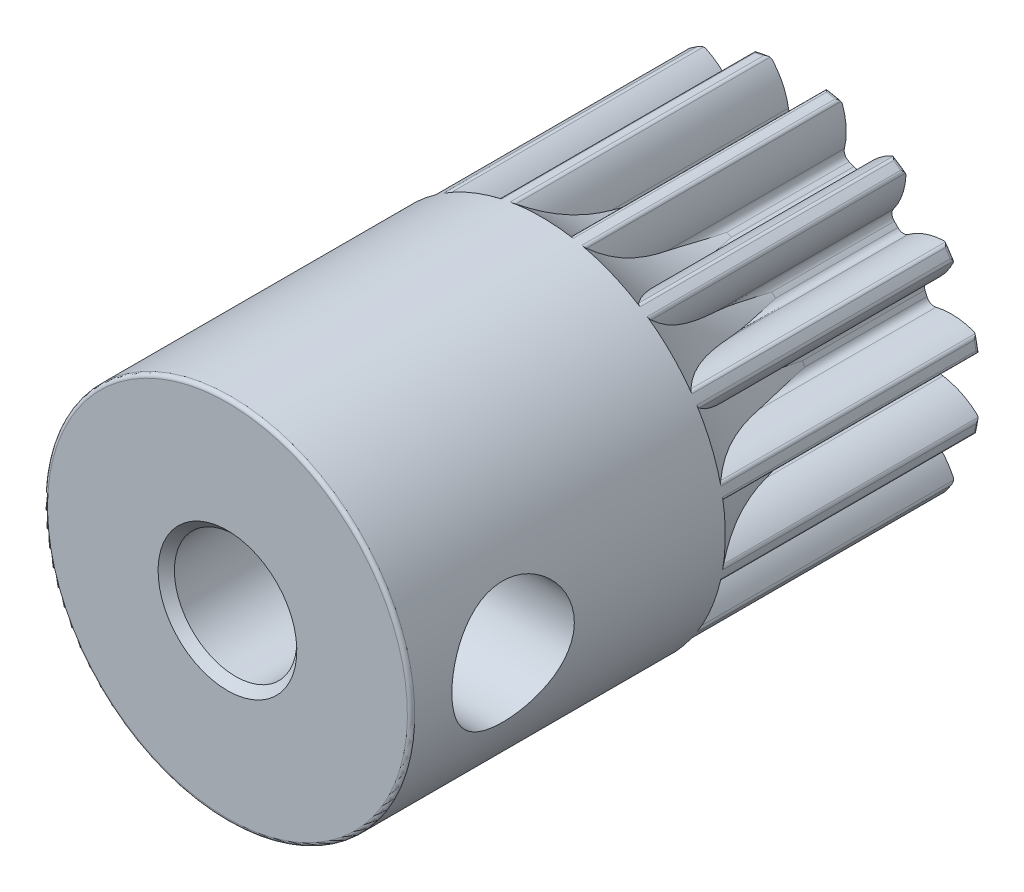
from build123d import *

# Parameters (mm, degrees)
FILLET2_R               = 0.09
CUT_EXTRUDE2_DEPTH      = 6.3
FILLET3_R               = 0.190000001
FILLET4_R               = 0.095000001
CIRPATTERN1_DEPTH       = 6.3
CHAMFER1_SIZE           = 0.2
CUT_EXTRUDE3_REACH      = 19.241
CUT_EXTRUDE3_END_RADIUS = 1.5
SKETCH8_R               = 1.5


# Read off the part's stored shape, not the designer's step: CirPattern1
with BuildPart() as part:
    # Sketch4 → Revolve1 (revolve)
    with BuildSketch(Plane(origin=(0, 0, 0), x_dir=(0, 0, -1), z_dir=(1, 0, 0))):
        Polygon((-14, 1.5), (-14, 4.5), (-3, 4.5), (0, 4.5), (0, 1.5), align=None)
    revolve(axis=Axis((0, 0, 3), (0, 0, 1)))

    # Fillet2
    fillet2_edges = [part.edges().sort_by_distance(p)[0] for p in [
        (0, -4.5, 0),
        (0, -4.5, 14),
    ]]
    fillet(fillet2_edges, radius=FILLET2_R)

    # Sketch7 → Cut-Extrude2 (cut)
    with BuildSketch(Plane.XY):
        with BuildLine():
            ThreePointArc((-0.724826987, 4.441241475), (0, 4.5), (0.724826987, 4.441241475))
            ThreePointArc((0.724826987, 4.441241475), (0.378010211, 3.95063267), (0.236597231, 3.366696676))
            ThreePointArc((0.236597231, 3.366696676), (0, 3.374999964), (-0.236597231, 3.366696676))
            ThreePointArc((-0.236597231, 3.366696676), (-0.378010211, 3.95063267), (-0.724826987, 4.441241475))
        make_face()
    extrude(amount=CUT_EXTRUDE2_DEPTH, mode=Mode.SUBTRACT)

    # Fillet3
    fillet3_edges = [part.edges().sort_by_distance(p)[0] for p in [
        (0.236597231, 3.366696676, 3.15),
        (-0.236597231, 3.366696676, 3.15),
    ]]
    fillet(fillet3_edges, radius=FILLET3_R)

    # Fillet4
    # the kernel refuses this fillet: 0.095000001 mm, written as the material it takes off along each edge
    with BuildSketch(Plane(origin=(0.724826987, 4.441241475, -0.035825584), x_dir=(-0.7092939445034812, -0.7049128316967229, 0), z_dir=(0, 0, 1))) as fillet4_piece_1:
        with BuildLine():
            CenterArc((0.048836055, 0.094988249), FILLET4_R * 0.999999994737, 215.280156673, 55.621039851)
            ThreePointArc((-0.028716024, 0.04011863), (-0.014412994, 0.020019961), (0, 0))
            ThreePointArc((0, 0), (0.025165117, -0.000197913), (0.050330234, 0))
        make_face()
    extrude(amount=6.335825584, mode=Mode.SUBTRACT)
    with BuildSketch(Plane(origin=(-0.724826987, 4.441241475, -0.035825584), x_dir=(0.709293944503482, -0.7049128316967221, 0), z_dir=(0, 0, 1))) as fillet4_piece_2:
        with BuildLine():
            CenterArc((0.048836055, -0.094988249), FILLET4_R * 0.999999994737, 89.098803476, 55.621039851)
            ThreePointArc((-0.028716024, -0.04011863), (-0.014412994, -0.020019961), (0, 0))
            ThreePointArc((0, 0), (0.025165117, 0.000197913), (0.050330234, 0))
        make_face()
    extrude(amount=6.335825584, mode=Mode.SUBTRACT)

    # CirPattern1 outline → CirPattern1 (cut)
    with BuildSketch(Plane.XY):
        with BuildLine():
            ThreePointArc((1.118375515, 3.363153899), (1.1344207, 3.230726591), (1.233569425, 3.141485513))
            ThreePointArc((1.233569425, 3.141485513), (1.29155657, 3.118093389), (1.349100404, 3.093631015))
            ThreePointArc((1.349100404, 3.093631015), (1.482312111, 3.086625251), (1.587298017, 3.168919839))
            ThreePointArc((1.587298017, 3.168919839), (1.905314001, 3.545079708), (2.322683832, 3.806676415))
            ThreePointArc((2.322683832, 3.806676415), (2.367741543, 3.814069788), (2.41104425, 3.79958756))
            ThreePointArc((2.41104425, 3.79958756), (1.722075445, 4.157457896), (0.98184839, 4.391579868))
            ThreePointArc((0.98184839, 4.391579868), (1.022708509, 4.371200713), (1.049341218, 4.334112195))
            ThreePointArc((1.049341218, 4.334112195), (1.159489451, 3.854010352), (1.118375515, 3.363153899))
        make_face()
        with BuildLine():
            ThreePointArc((-1.049341218, 4.334112195), (-1.022708509, 4.371200713), (-0.98184839, 4.391579868))
            ThreePointArc((-0.98184839, 4.391579868), (-1.722075445, 4.157457896), (-2.41104425, 3.79958756))
            ThreePointArc((-2.41104425, 3.79958756), (-2.367741543, 3.814069788), (-2.322683832, 3.806676415))
            ThreePointArc((-2.322683832, 3.806676415), (-1.905314001, 3.545079708), (-1.587298017, 3.168919839))
            ThreePointArc((-1.587298017, 3.168919839), (-1.482312111, 3.086625251), (-1.349100404, 3.093631015))
            ThreePointArc((-1.349100404, 3.093631015), (-1.29155657, 3.118093389), (-1.233569425, 3.141485513))
            ThreePointArc((-1.233569425, 3.141485513), (-1.1344207, 3.230726591), (-1.118375515, 3.363153899))
            ThreePointArc((-1.118375515, 3.363153899), (-1.159489451, 3.854010352), (-1.049341218, 4.334112195))
        make_face()
        with BuildLine():
            ThreePointArc((3.681553644, 2.587694489), (3.181980515, 3.181980515), (2.587694489, 3.681553644))
            ThreePointArc((2.587694489, 3.681553644), (2.617645552, 3.647089268), (2.628057805, 3.602632049))
            ThreePointArc((2.628057805, 3.602632049), (2.546094482, 3.116923879), (2.320267526, 2.679165271))
            ThreePointArc((2.320267526, 2.679165271), (2.284413607, 2.550678166), (2.341864003, 2.430287586))
            ThreePointArc((2.341864003, 2.430287586), (2.386485361, 2.386485361), (2.430287586, 2.341864003))
            ThreePointArc((2.430287586, 2.341864003), (2.550678166, 2.284413607), (2.679165271, 2.320267526))
            ThreePointArc((2.679165271, 2.320267526), (3.116923879, 2.546094482), (3.602632049, 2.628057805))
            ThreePointArc((3.602632049, 2.628057805), (3.647089268, 2.617645552), (3.681553644, 2.587694489))
        make_face()
        with BuildLine():
            ThreePointArc((-2.628057805, 3.602632049), (-2.617645552, 3.647089268), (-2.587694489, 3.681553644))
            ThreePointArc((-2.587694489, 3.681553644), (-3.181980515, 3.181980515), (-3.681553644, 2.587694489))
            ThreePointArc((-3.681553644, 2.587694489), (-3.647089268, 2.617645552), (-3.602632049, 2.628057805))
            ThreePointArc((-3.602632049, 2.628057805), (-3.116923879, 2.546094482), (-2.679165271, 2.320267526))
            ThreePointArc((-2.679165271, 2.320267526), (-2.550678166, 2.284413607), (-2.430287586, 2.341864003))
            ThreePointArc((-2.430287586, 2.341864003), (-2.386485361, 2.386485361), (-2.341864003, 2.430287586))
            ThreePointArc((-2.341864003, 2.430287586), (-2.284413607, 2.550678166), (-2.320267526, 2.679165271))
            ThreePointArc((-2.320267526, 2.679165271), (-2.546094482, 3.116923879), (-2.628057805, 3.602632049))
        make_face()
        with BuildLine():
            ThreePointArc((4.391579868, 0.98184839), (4.157457896, 1.722075445), (3.79958756, 2.41104425))
            ThreePointArc((3.79958756, 2.41104425), (3.814069788, 2.367741543), (3.806676415, 2.322683832))
            ThreePointArc((3.806676415, 2.322683832), (3.545079708, 1.905314001), (3.168919839, 1.587298017))
            ThreePointArc((3.168919839, 1.587298017), (3.086625251, 1.482312111), (3.093631015, 1.349100404))
            ThreePointArc((3.093631015, 1.349100404), (3.118093389, 1.29155657), (3.141485513, 1.233569425))
            ThreePointArc((3.141485513, 1.233569425), (3.230726591, 1.1344207), (3.363153899, 1.118375515))
            ThreePointArc((3.363153899, 1.118375515), (3.854010352, 1.159489451), (4.334112195, 1.049341218))
            ThreePointArc((4.334112195, 1.049341218), (4.371200713, 1.022708509), (4.391579868, 0.98184839))
        make_face()
        with BuildLine():
            ThreePointArc((-3.806676415, 2.322683832), (-3.814069788, 2.367741543), (-3.79958756, 2.41104425))
            ThreePointArc((-3.79958756, 2.41104425), (-4.157457896, 1.722075445), (-4.391579868, 0.98184839))
            ThreePointArc((-4.391579868, 0.98184839), (-4.371200713, 1.022708509), (-4.334112195, 1.049341218))
            ThreePointArc((-4.334112195, 1.049341218), (-3.854010352, 1.159489451), (-3.363153899, 1.118375515))
            ThreePointArc((-3.363153899, 1.118375515), (-3.230726591, 1.1344207), (-3.141485513, 1.233569425))
            ThreePointArc((-3.141485513, 1.233569425), (-3.118093389, 1.29155657), (-3.093631015, 1.349100404))
            ThreePointArc((-3.093631015, 1.349100404), (-3.086625251, 1.482312111), (-3.168919839, 1.587298017))
            ThreePointArc((-3.168919839, 1.587298017), (-3.545079708, 1.905314001), (-3.806676415, 2.322683832))
        make_face()
        with BuildLine():
            ThreePointArc((4.433027868, -0.773475226), (4.5, 0), (4.433027868, 0.773475226))
            ThreePointArc((4.433027868, 0.773475226), (4.429836473, 0.727926633), (4.405763047, 0.689128057))
            ThreePointArc((4.405763047, 0.689128057), (4.004358684, 0.403637338), (3.535132832, 0.253779029))
            ThreePointArc((3.535132832, 0.253779029), (3.41892618, 0.188277475), (3.374420749, 0.062524915))
            ThreePointArc((3.374420749, 0.062524915), (3.374999964, 0), (3.374420749, -0.062524915))
            ThreePointArc((3.374420749, -0.062524915), (3.41892618, -0.188277475), (3.535132832, -0.253779029))
            ThreePointArc((3.535132832, -0.253779029), (4.004358684, -0.403637338), (4.405763047, -0.689128057))
            ThreePointArc((4.405763047, -0.689128057), (4.429836473, -0.727926633), (4.433027868, -0.773475226))
        make_face()
        with BuildLine():
            ThreePointArc((-4.405763047, 0.689128057), (-4.429836473, 0.727926633), (-4.433027868, 0.773475226))
            ThreePointArc((-4.433027868, 0.773475226), (-4.5, 0), (-4.433027868, -0.773475226))
            ThreePointArc((-4.433027868, -0.773475226), (-4.429836473, -0.727926633), (-4.405763047, -0.689128057))
            ThreePointArc((-4.405763047, -0.689128057), (-4.004358684, -0.403637338), (-3.535132832, -0.253779029))
            ThreePointArc((-3.535132832, -0.253779029), (-3.41892618, -0.188277475), (-3.374420749, -0.062524915))
            ThreePointArc((-3.374420749, -0.062524915), (-3.374999964, 0), (-3.374420749, 0.062524915))
            ThreePointArc((-3.374420749, 0.062524915), (-3.41892618, 0.188277475), (-3.535132832, 0.253779029))
            ThreePointArc((-3.535132832, 0.253779029), (-4.004358684, 0.403637338), (-4.405763047, 0.689128057))
        make_face()
        with BuildLine():
            ThreePointArc((3.79958756, -2.41104425), (4.157457896, -1.722075445), (4.391579868, -0.98184839))
            ThreePointArc((4.391579868, -0.98184839), (4.371200713, -1.022708509), (4.334112195, -1.049341218))
            ThreePointArc((4.334112195, -1.049341218), (3.854010352, -1.159489451), (3.363153899, -1.118375515))
            ThreePointArc((3.363153899, -1.118375515), (3.230726591, -1.1344207), (3.141485513, -1.233569425))
            ThreePointArc((3.141485513, -1.233569425), (3.118093389, -1.29155657), (3.093631015, -1.349100404))
            ThreePointArc((3.093631015, -1.349100404), (3.086625251, -1.482312111), (3.168919839, -1.587298017))
            ThreePointArc((3.168919839, -1.587298017), (3.545079708, -1.905314001), (3.806676415, -2.322683832))
            ThreePointArc((3.806676415, -2.322683832), (3.814069788, -2.367741543), (3.79958756, -2.41104425))
        make_face()
        with BuildLine():
            ThreePointArc((-4.334112195, -1.049341218), (-4.371200713, -1.022708509), (-4.391579868, -0.98184839))
            ThreePointArc((-4.391579868, -0.98184839), (-4.157457896, -1.722075445), (-3.79958756, -2.41104425))
            ThreePointArc((-3.79958756, -2.41104425), (-3.814069788, -2.367741543), (-3.806676415, -2.322683832))
            ThreePointArc((-3.806676415, -2.322683832), (-3.545079708, -1.905314001), (-3.168919839, -1.587298017))
            ThreePointArc((-3.168919839, -1.587298017), (-3.086625251, -1.482312111), (-3.093631015, -1.349100404))
            ThreePointArc((-3.093631015, -1.349100404), (-3.118093389, -1.29155657), (-3.141485513, -1.233569425))
            ThreePointArc((-3.141485513, -1.233569425), (-3.230726591, -1.1344207), (-3.363153899, -1.118375515))
            ThreePointArc((-3.363153899, -1.118375515), (-3.854010352, -1.159489451), (-4.334112195, -1.049341218))
        make_face()
        with BuildLine():
            ThreePointArc((2.587694489, -3.681553644), (3.181980515, -3.181980515), (3.681553644, -2.587694489))
            ThreePointArc((3.681553644, -2.587694489), (3.647089268, -2.617645552), (3.602632049, -2.628057805))
            ThreePointArc((3.602632049, -2.628057805), (3.116923879, -2.546094482), (2.679165271, -2.320267526))
            ThreePointArc((2.679165271, -2.320267526), (2.550678166, -2.284413607), (2.430287586, -2.341864003))
            ThreePointArc((2.430287586, -2.341864003), (2.386485361, -2.386485361), (2.341864003, -2.430287586))
            ThreePointArc((2.341864003, -2.430287586), (2.284413607, -2.550678166), (2.320267526, -2.679165271))
            ThreePointArc((2.320267526, -2.679165271), (2.546094482, -3.116923879), (2.628057805, -3.602632049))
            ThreePointArc((2.628057805, -3.602632049), (2.617645552, -3.647089268), (2.587694489, -3.681553644))
        make_face()
        with BuildLine():
            ThreePointArc((-3.602632049, -2.628057805), (-3.647089268, -2.617645552), (-3.681553644, -2.587694489))
            ThreePointArc((-3.681553644, -2.587694489), (-3.181980515, -3.181980515), (-2.587694489, -3.681553644))
            ThreePointArc((-2.587694489, -3.681553644), (-2.617645552, -3.647089268), (-2.628057805, -3.602632049))
            ThreePointArc((-2.628057805, -3.602632049), (-2.546094482, -3.116923879), (-2.320267526, -2.679165271))
            ThreePointArc((-2.320267526, -2.679165271), (-2.284413607, -2.550678166), (-2.341864003, -2.430287586))
            ThreePointArc((-2.341864003, -2.430287586), (-2.386485361, -2.386485361), (-2.430287586, -2.341864003))
            ThreePointArc((-2.430287586, -2.341864003), (-2.550678166, -2.284413607), (-2.679165271, -2.320267526))
            ThreePointArc((-2.679165271, -2.320267526), (-3.116923879, -2.546094482), (-3.602632049, -2.628057805))
        make_face()
        with BuildLine():
            ThreePointArc((0.98184839, -4.391579868), (1.722075445, -4.157457896), (2.41104425, -3.79958756))
            ThreePointArc((2.41104425, -3.79958756), (2.367741543, -3.814069788), (2.322683832, -3.806676415))
            ThreePointArc((2.322683832, -3.806676415), (1.905314001, -3.545079708), (1.587298017, -3.168919839))
            ThreePointArc((1.587298017, -3.168919839), (1.482312111, -3.086625251), (1.349100404, -3.093631015))
            ThreePointArc((1.349100404, -3.093631015), (1.29155657, -3.118093389), (1.233569425, -3.141485513))
            ThreePointArc((1.233569425, -3.141485513), (1.1344207, -3.230726591), (1.118375515, -3.363153899))
            ThreePointArc((1.118375515, -3.363153899), (1.159489451, -3.854010352), (1.049341218, -4.334112195))
            ThreePointArc((1.049341218, -4.334112195), (1.022708509, -4.371200713), (0.98184839, -4.391579868))
        make_face()
        with BuildLine():
            ThreePointArc((-2.322683832, -3.806676415), (-2.367741543, -3.814069788), (-2.41104425, -3.79958756))
            ThreePointArc((-2.41104425, -3.79958756), (-1.722075445, -4.157457896), (-0.98184839, -4.391579868))
            ThreePointArc((-0.98184839, -4.391579868), (-1.022708509, -4.371200713), (-1.049341218, -4.334112195))
            ThreePointArc((-1.049341218, -4.334112195), (-1.159489451, -3.854010352), (-1.118375515, -3.363153899))
            ThreePointArc((-1.118375515, -3.363153899), (-1.1344207, -3.230726591), (-1.233569425, -3.141485513))
            ThreePointArc((-1.233569425, -3.141485513), (-1.29155657, -3.118093389), (-1.349100404, -3.093631015))
            ThreePointArc((-1.349100404, -3.093631015), (-1.482312111, -3.086625251), (-1.587298017, -3.168919839))
            ThreePointArc((-1.587298017, -3.168919839), (-1.905314001, -3.545079708), (-2.322683832, -3.806676415))
        make_face()
        with BuildLine():
            ThreePointArc((-0.773475226, -4.433027868), (0, -4.5), (0.773475226, -4.433027868))
            ThreePointArc((0.773475226, -4.433027868), (0.727926633, -4.429836473), (0.689128057, -4.405763047))
            ThreePointArc((0.689128057, -4.405763047), (0.403637338, -4.004358684), (0.253779029, -3.535132832))
            ThreePointArc((0.253779029, -3.535132832), (0.188277475, -3.41892618), (0.062524915, -3.374420749))
            ThreePointArc((0.062524915, -3.374420749), (0, -3.374999964), (-0.062524915, -3.374420749))
            ThreePointArc((-0.062524915, -3.374420749), (-0.188277475, -3.41892618), (-0.253779029, -3.535132832))
            ThreePointArc((-0.253779029, -3.535132832), (-0.403637338, -4.004358684), (-0.689128057, -4.405763047))
            ThreePointArc((-0.689128057, -4.405763047), (-0.727926633, -4.429836473), (-0.773475226, -4.433027868))
        make_face()
    extrude(amount=CIRPATTERN1_DEPTH, mode=Mode.SUBTRACT)

    # Sketch10 → Revolve2 (revolve)
    with BuildSketch(Plane(origin=(0, 0, 0), x_dir=(0, 0, -1), z_dir=(1, 0, 0)), mode=Mode.PRIVATE) as revolve2_sk:
        with BuildLine():
            Line((-6.3, 4.5), (-6.3, 3.374388141))
            Line((-6.3, 3.374388141), (-3, 3.374999964))
            ThreePointArc((-3, 3.374999964), (-4.743245901, 3.663978682), (-6.3, 4.5))
        make_face()
    revolve(revolve2_sk.sketch.rotate(Axis((0, 0, 0), (0, 0, 1)), 350.102658959), axis=Axis((0, 0, 0), (0, 0, 1)))

    # Chamfer1
    chamfer1_edges = [part.edges().sort_by_distance(p)[0] for p in [
        (0, -1.5, 0),
        (0, -1.5, 14),
    ]]
    chamfer(chamfer1_edges, length=CHAMFER1_SIZE)

    # Cut-Extrude3: up to this cylinder (the profile starts outside it)
    cut_extrude3_end = Plane(origin=(0, 0, 11.5), z_dir=(0, 0, -1)) * Cylinder(CUT_EXTRUDE3_END_RADIUS, 42.482, mode=Mode.PRIVATE)
    # Sketch8 → Cut-Extrude3 (cut, up to the surface)
    with BuildSketch(Plane(origin=(4.5, 0, 0), x_dir=(0, 0, -1), z_dir=(1, 0, 0)), mode=Mode.PRIVATE) as cut_extrude3_sk1:
        with Locations((-11.5, 0)):
            Circle(SKETCH8_R)
    cut_extrude3_tool1 = extrude(cut_extrude3_sk1.sketch, amount=-CUT_EXTRUDE3_REACH, mode=Mode.PRIVATE) - cut_extrude3_end
    add(cut_extrude3_tool1.solids().sort_by_distance((4.5, 0, 11.5))[0], mode=Mode.SUBTRACT)


solid = part.part
